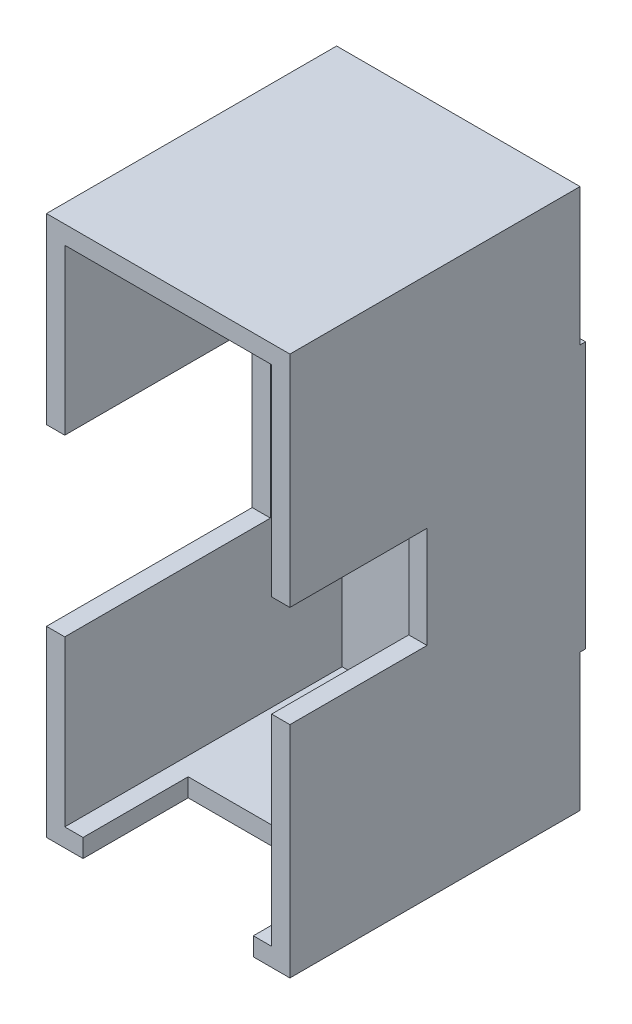
from build123d import *

# Parameters (mm, degrees)
SKETCH1_W           = 53.25
SKETCH1_H           = 118.2
SKETCH1_W_2         = 45.25
SKETCH1_H_2         = 110.2
BOSS_EXTRUDE1_DEPTH = 60.67
SKETCH2_W           = 53.25
SKETCH2_H           = 118.2
BOSS_EXTRUDE2_DEPTH = 4
SKETCH3_W           = 30
SKETCH3_H           = 22.2
CUT_EXTRUDE1_DEPTH  = 4
SKETCH4_W           = 45
SKETCH4_H           = 38.2
CUT_EXTRUDE2_DEPTH  = 4
SKETCH5_W           = 37.25
SKETCH5_H           = 23
CUT_EXTRUDE3_DEPTH  = 4
SKETCH6_R           = 8
SKETCH6_R_2         = 6
BOSS_EXTRUDE3_DEPTH = 1.5
SKETCH9_R           = 6
CUT_EXTRUDE4_DEPTH  = 5.5
SKETCH10_W          = 1.2
SKETCH10_H          = 30
CUT_EXTRUDE6_DEPTH  = 101.046096376
SKETCH8_R           = 8
BOSS_EXTRUDE5_DEPTH = 3
SKETCH12_R          = 3.325
CUT_EXTRUDE8_DEPTH  = 86.771612582


with BuildPart() as part:
    # Sketch1 → Boss-Extrude1 (new body)
    with BuildSketch(Plane.XY):
        Rectangle(SKETCH1_W, SKETCH1_H)
        Rectangle(SKETCH1_W_2, SKETCH1_H_2, mode=Mode.SUBTRACT)
    extrude(amount=BOSS_EXTRUDE1_DEPTH)

    # Sketch2 → Boss-Extrude2 (add)
    with BuildSketch(Plane.XY):
        Rectangle(SKETCH2_W, SKETCH2_H)
    extrude(amount=-BOSS_EXTRUDE2_DEPTH)

    # Sketch3 → Cut-Extrude1 (cut)
    with BuildSketch(Plane(origin=(26.625, 0, 0), x_dir=(0, 0, -1), z_dir=(1, 0, 0))):
        with Locations((-45.67, 0)):
            Rectangle(SKETCH3_W, SKETCH3_H)
    extrude(amount=-CUT_EXTRUDE1_DEPTH, mode=Mode.SUBTRACT)

    # Sketch4 → Cut-Extrude2 (cut)
    with BuildSketch(Plane.ZY.offset(26.625)):
        with Locations((38.17, 0)):
            Rectangle(SKETCH4_W, SKETCH4_H)
    extrude(amount=-CUT_EXTRUDE2_DEPTH, mode=Mode.SUBTRACT)

    # Sketch5 → Cut-Extrude3 (cut)
    with BuildSketch(Plane.XZ.offset(59.1)):
        with Locations((0, 49.17)):
            Rectangle(SKETCH5_W, SKETCH5_H)
    extrude(amount=-CUT_EXTRUDE3_DEPTH, mode=Mode.SUBTRACT)

    # Sketch6 → Boss-Extrude3 (add)
    with BuildSketch(Plane.XY):
        Circle(SKETCH6_R)
        Circle(SKETCH6_R_2, mode=Mode.SUBTRACT)
    extrude(amount=BOSS_EXTRUDE3_DEPTH)

    # Sketch9 → Cut-Extrude4 (cut)
    with BuildSketch(Plane(origin=(0, 0, -4), x_dir=(-1, 0, 0), z_dir=(0, 0, -1))):
        Circle(SKETCH9_R)
    extrude(amount=-CUT_EXTRUDE4_DEPTH, mode=Mode.SUBTRACT)

    # Sketch10 → Cut-Extrude6 (cut, through all)
    with BuildSketch(Plane(origin=(26.625, 0, 0), x_dir=(0, 0, -1), z_dir=(1, 0, 0))):
        with Locations((3.4, 44.1)):
            Rectangle(SKETCH10_W, SKETCH10_H)
        with Locations((3.4, -44.1)):
            Rectangle(SKETCH10_W, SKETCH10_H)
    extrude(amount=-CUT_EXTRUDE6_DEPTH, mode=Mode.SUBTRACT)

    # Sketch8 → Boss-Extrude5 (add)
    with BuildSketch(Plane.XY.offset(1.5)):
        Circle(SKETCH8_R)
    extrude(amount=BOSS_EXTRUDE5_DEPTH)

    # Sketch12 → Cut-Extrude8 (cut, through all)
    with BuildSketch(Plane.XY.offset(4.5)):
        Circle(SKETCH12_R)
    extrude(amount=-CUT_EXTRUDE8_DEPTH, mode=Mode.SUBTRACT)


solid = part.part
